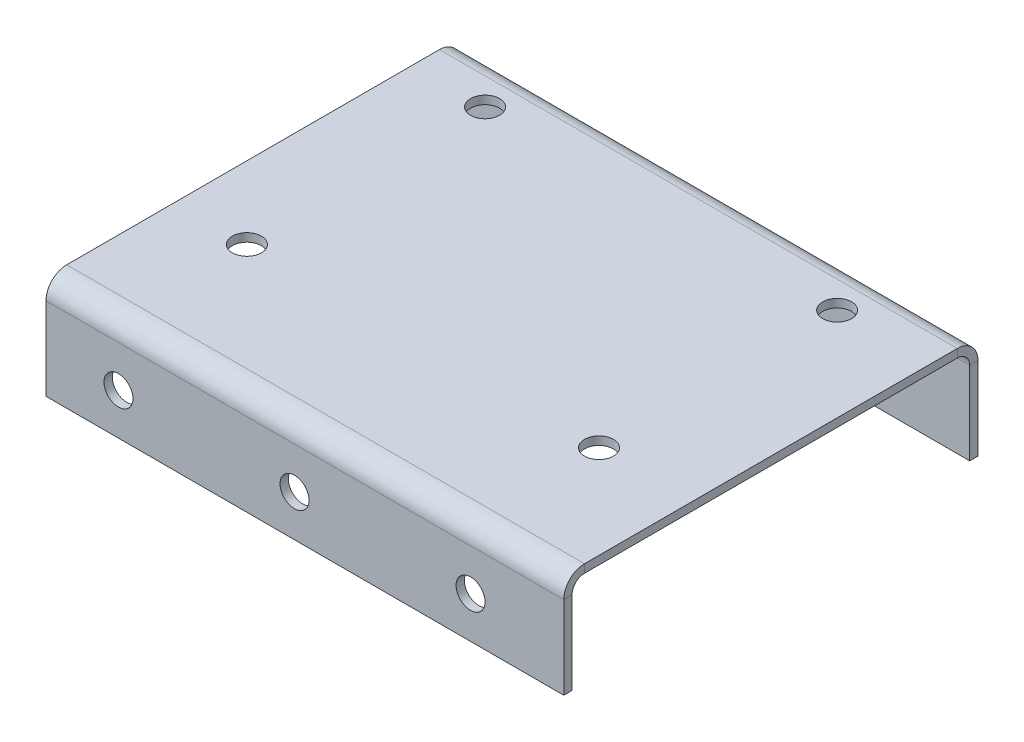
from build123d import *

# Parameters (mm, degrees)
BASE_FLANGE1_DEPTH = 125
SKETCH6_R          = 7
CUT_EXTRUDE1_DEPTH = 10
SKETCH7_R          = 7
CUT_EXTRUDE2_DEPTH = 10


# Sheet-metal steps are written as plain solids
with BuildPart() as part:
    # Sketch1 → Base-Flange1 (new, symmetric)
    with BuildSketch(Plane(origin=(0, 0, 0), x_dir=(0, 0, -1), z_dir=(1, 0, 0))):
        with BuildLine():
            Line((0, 36.811428571), (0, 76.811428571))
            ThreePointArc((0, 76.811428571), (2.928932188, 83.882496383), (10, 86.811428571))
            Line((10, 86.811428571), (190, 86.811428571))
            ThreePointArc((190, 86.811428571), (197.071067812, 83.882496383), (200, 76.811428571))
            Line((200, 76.811428571), (200, 36.811428571))
            Line((200, 36.811428571), (196, 36.811428571))
            Line((196, 36.811428571), (196, 76.811428571))
            ThreePointArc((196, 76.811428571), (194.242640687, 81.054069259), (190, 82.811428571))
            Line((190, 82.811428571), (10, 82.811428571))
            ThreePointArc((10, 82.811428571), (5.757359313, 81.054069259), (4, 76.811428571))
            Line((4, 76.811428571), (4, 36.811428571))
            Line((4, 36.811428571), (0, 36.811428571))
        make_face()
    extrude(amount=BASE_FLANGE1_DEPTH, both=True)

    # Sketch6 → Cut-Extrude1 (cut)
    with BuildSketch(Plane(origin=(0, 86.811428571, 0), x_dir=(1, 0, 0), z_dir=(0, 1, 0))):
        with Locations(Location((-90, 177, 0), (0, 0, 270))):
            Circle(SKETCH6_R)
        with Locations(Location((80, 177, 0), (0, 0, 270))):
            Circle(SKETCH6_R)
        with Locations(Location((80, 62, 0), (0, 0, 270))):
            Circle(SKETCH6_R)
        with Locations(Location((-90, 62, 0), (0, 0, 270))):
            Circle(SKETCH6_R)
    extrude(amount=-CUT_EXTRUDE1_DEPTH, mode=Mode.SUBTRACT)

    # Sketch7 → Cut-Extrude2 (cut)
    with BuildSketch(Plane.XY):
        with Locations((-90, 56.811428571)):
            Circle(SKETCH7_R)
        with Locations((-5, 56.811428571)):
            Circle(SKETCH7_R)
        with Locations((80, 56.811428571)):
            Circle(SKETCH7_R)
    extrude(amount=-CUT_EXTRUDE2_DEPTH, mode=Mode.SUBTRACT)


solid = part.part
